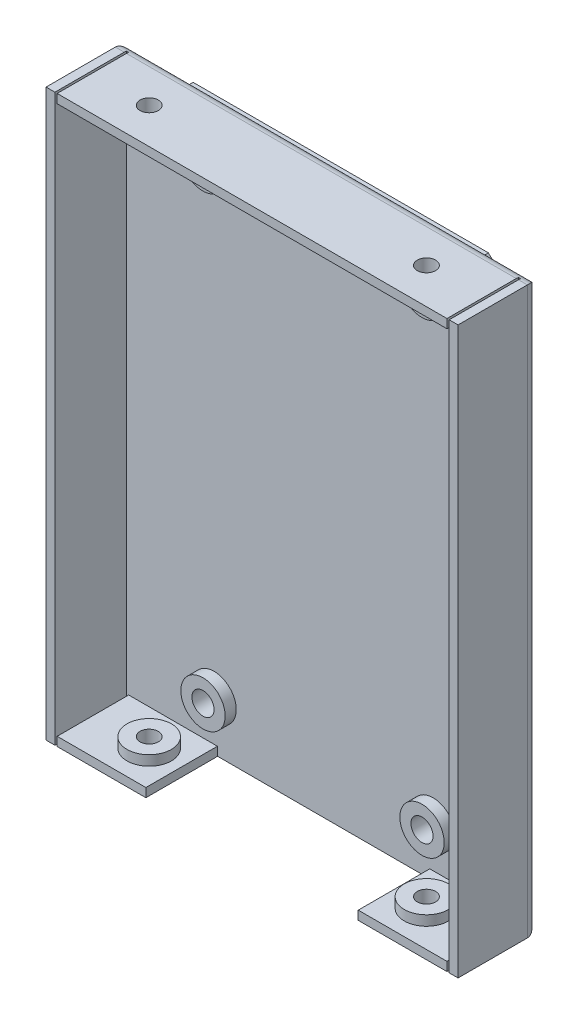
from build123d import *

# Parameters (mm, degrees)
SKETCH1_W                 = 74.3
SKETCH1_H                 = 102
BOSS_EXTRUDE1_DEPTH       = 1.6
SKETCH2_W                 = 1.6
SKETCH2_H                 = 102
SKETCH2_W_2               = 16
SKETCH2_H_2               = 1.6
SKETCH2_W_3               = 70.3
BOSS_EXTRUDE2_DEPTH       = 12.9
FILLET1_R                 = 2
SKETCH3_R                 = 4
SKETCH3_R_2               = 2
BOSS_EXTRUDE3_DEPTH       = 2
CUT_EXTRUDE1_START        = -1.6
SKETCH3_3_R               = 2
CUT_EXTRUDE1_DEPTH        = 1.6
SKETCH4_W                 = 62.25
SKETCH4_H                 = 97.2
SKETCH4_R                 = 2
SKETCH4_R_2               = 1.525
SKETCH4_W_2               = 29
SKETCH4_H_2               = 7.9
BOSS_EXTRUDE4_DEPTH       = 1.5
CHAMFER1_SIZE             = 4.5
SKETCH7_R                 = 8
SKETCH7_R_2               = 6.75
BOSS_EXTRUDE5_DEPTH       = 2.8
SKETCH9_R                 = 1.65
CUT_EXTRUDE4_DEPTH        = 126.741401296
BOSS_EXTRUDE7_START       = 1.8
SKETCH9_6_R               = 4
SKETCH9_6_R_2             = 1.65
BOSS_EXTRUDE7_DEPTH       = 1.8
MIRROR3_COPY_1_SKETCH_R   = 1.65
MIRROR3_COPY_1_DEPTH      = 126.741401296
MIRROR3_START             = 1.8
MIRROR3_COPY_2_SKETCH_R   = 4
MIRROR3_COPY_2_SKETCH_R_2 = 1.65
MIRROR3_COPY_2_DEPTH      = 1.8


with BuildPart() as part:
    # Sketch1 → Boss-Extrude1 (new body)
    with BuildSketch(Plane.XY):
        with Locations((37.15, 51)):
            Rectangle(SKETCH1_W, SKETCH1_H)
    extrude(amount=BOSS_EXTRUDE1_DEPTH)

    # Sketch2 → Boss-Extrude2 (add)
    with BuildSketch(Plane.XY.offset(1.6)):
        with Locations((0.8, 51)):
            Rectangle(SKETCH2_W, SKETCH2_H)
        with Locations((73.5, 51)):
            Rectangle(SKETCH2_W, SKETCH2_H)
        with Locations((64.3, 0.8)):
            Rectangle(SKETCH2_W_2, SKETCH2_H_2)
        with Locations((37.15, 101.2)):
            Rectangle(SKETCH2_W_3, SKETCH2_H_2)
        with Locations((10, 0.8)):
            Rectangle(SKETCH2_W_2, SKETCH2_H_2)
    extrude(amount=BOSS_EXTRUDE2_DEPTH)

    # Fillet1
    # the kernel refuses this fillet: 2 mm, written as the material it takes off along each edge
    with BuildSketch(Plane(origin=(0, 107, 0), x_dir=(1, 0, 0), z_dir=(0, -1, 0)), Plane(origin=(74.3, -5, 0), x_dir=(-1, 0, 0), z_dir=(0, 1, 0))) as fillet1_piece_1:
        with BuildLine():
            CenterArc((FILLET1_R, FILLET1_R), FILLET1_R, 180, 90)
            Line((0, FILLET1_R), (0, 0))
            Line((0, 0), (FILLET1_R, 0))
        make_face()
    extrude(amount=112, mode=Mode.SUBTRACT)
    with BuildSketch(Plane(origin=(-5, 0, 0), x_dir=(0, 0, 1), z_dir=(1, 0, 0))) as fillet1_piece_2:
        with BuildLine():
            CenterArc((FILLET1_R, -FILLET1_R), FILLET1_R, 90, 90)
            Line((0, -FILLET1_R), (0, 0))
            Line((0, 0), (FILLET1_R, 0))
        make_face()
    extrude(amount=84.3, mode=Mode.SUBTRACT)
    with BuildSketch(Plane(origin=(79.3, 102, 0), x_dir=(0, -1, 0), z_dir=(-1, 0, 0))) as fillet1_piece_3:
        with BuildLine():
            CenterArc((FILLET1_R, FILLET1_R), FILLET1_R, 180, 90)
            Line((0, FILLET1_R), (0, 0))
            Line((0, 0), (FILLET1_R, 0))
        make_face()
    extrude(amount=84.3, mode=Mode.SUBTRACT)

    # Sketch3 → Boss-Extrude3 (add)
    # profile 1 of 4: a face of its own
    with BuildSketch(Plane.XY.offset(1.6)):
        with Locations(Location((17.4, 9, 0), (0, 0, 180))):
            Circle(SKETCH3_R)
        with Locations((17.4, 9)):
            Circle(SKETCH3_R_2, mode=Mode.SUBTRACT)
    # profile 2 of 4: a face of its own
    with BuildSketch(Plane.XY.offset(1.6)):
        with Locations(Location((56.9, 9, 0), (0, 0, 180))):
            Circle(SKETCH3_R)
        with Locations(Location((56.9, 9, 0), (0, 0, 180))):
            Circle(SKETCH3_R_2, mode=Mode.SUBTRACT)
    # profile 3 of 4: a face of its own
    with BuildSketch(Plane.XY.offset(1.6)):
        with Locations(Location((56.9, 93, 0), (0, 0, 180))):
            Circle(SKETCH3_R)
        with Locations((56.9, 93)):
            Circle(SKETCH3_R_2, mode=Mode.SUBTRACT)
    # profile 4 of 4: a face of its own
    with BuildSketch(Plane.XY.offset(1.6)):
        with Locations(Location((17.4, 93, 0), (0, 0, 180))):
            Circle(SKETCH3_R)
        with Locations(Location((17.4, 93, 0), (0, 0, 180))):
            Circle(SKETCH3_R_2, mode=Mode.SUBTRACT)
    extrude(amount=BOSS_EXTRUDE3_DEPTH)

    # Sketch3<3> → Cut-Extrude1 (cut)
    with BuildSketch(Plane.XY.offset(1.6).offset(CUT_EXTRUDE1_START)):
        with Locations((17.4, 9)):
            Circle(SKETCH3_3_R)
        with Locations(Location((56.9, 9, 0), (0, 0, 180))):
            Circle(SKETCH3_3_R)
        with Locations((56.9, 93)):
            Circle(SKETCH3_3_R)
        with Locations(Location((17.4, 93, 0), (0, 0, 180))):
            Circle(SKETCH3_3_R)
    extrude(amount=CUT_EXTRUDE1_DEPTH, mode=Mode.SUBTRACT)

    # Sketch9 → Cut-Extrude4 (cut, through all)
    with BuildSketch(Plane(origin=(0, 1.6, 0), x_dir=(1, 0, 0), z_dir=(0, 1, 0))):
        with Locations(Location((12.15, -8.05, 0), (0, 0, 270))):
            Circle(SKETCH9_R)
    cut_extrude4 = extrude(amount=-CUT_EXTRUDE4_DEPTH, mode=Mode.SUBTRACT)

    # Sketch9<6> → Boss-Extrude7 (add)
    with BuildSketch(Plane(origin=(0, 1.6, 0), x_dir=(1, 0, 0), z_dir=(0, 1, 0)).offset(BOSS_EXTRUDE7_START)):
        with Locations(Location((12.15, -8.05, 0), (0, 0, 90))):
            Circle(SKETCH9_6_R)
        with Locations(Location((12.15, -8.05, 0), (0, 0, 270))):
            Circle(SKETCH9_6_R_2, mode=Mode.SUBTRACT)
    boss_extrude7 = extrude(amount=-BOSS_EXTRUDE7_DEPTH)

    # Mirror2: Cut-Extrude4, Boss-Extrude7 across plane
    add(cut_extrude4.mirror(Plane(origin=(37.15, 0, 0), x_dir=(0, 0, 1), z_dir=(1, 0, 0))), mode=Mode.SUBTRACT)
    add(boss_extrude7.mirror(Plane(origin=(37.15, 0, 0), x_dir=(0, 0, 1), z_dir=(1, 0, 0))))

    # Mirror3: Cut-Extrude4, Boss-Extrude7 across plane
    add(cut_extrude4.mirror(Plane.ZX.offset(51)), mode=Mode.SUBTRACT)
    add(boss_extrude7.mirror(Plane.ZX.offset(51)))

    # Mirror3 copy 1 sketch → Mirror3 copy 1 (cut, through all)
    with BuildSketch(Plane(origin=(74.3, 100.4, 0), x_dir=(-1, 0, 0), z_dir=(0, -1, 0))):
        with Locations(Location((12.15, -8.05, 0), (0, 0, 270))):
            Circle(MIRROR3_COPY_1_SKETCH_R)
    extrude(amount=-MIRROR3_COPY_1_DEPTH, mode=Mode.SUBTRACT)

    # Mirror3 copy 2 sketch → Mirror3 copy 2 (add)
    with BuildSketch(Plane(origin=(74.3, 100.4, 0), x_dir=(-1, 0, 0), z_dir=(0, -1, 0)).offset(MIRROR3_START)):
        with Locations(Location((12.15, -8.05, 0), (0, 0, 90))):
            Circle(MIRROR3_COPY_2_SKETCH_R)
        with Locations(Location((12.15, -8.05, 0), (0, 0, 270))):
            Circle(MIRROR3_COPY_2_SKETCH_R_2, mode=Mode.SUBTRACT)
    extrude(amount=-MIRROR3_COPY_2_DEPTH)


with BuildPart() as body_2:
    # Sketch4 → Boss-Extrude4 (new body)
    with BuildSketch(Plane(origin=(0, 0, 0), x_dir=(-1, 0, 0), z_dir=(0, 0, -1))):
        with Locations((-37.15, 51.4)):
            Rectangle(SKETCH4_W, SKETCH4_H)
        with Locations((-56.9, 93)):
            Circle(SKETCH4_R, mode=Mode.SUBTRACT)
        with Locations((-17.4, 93)):
            Circle(SKETCH4_R, mode=Mode.SUBTRACT)
        with Locations((-17.4, 9)):
            Circle(SKETCH4_R, mode=Mode.SUBTRACT)
        with Locations((-56.9, 9)):
            Circle(SKETCH4_R, mode=Mode.SUBTRACT)
        with Locations((-55.55, 64.55)):
            Circle(SKETCH4_R_2, mode=Mode.SUBTRACT)
        with Locations(Location((-18.75, 64.55, 0), (0, 0, 180))):
            Circle(SKETCH4_R_2, mode=Mode.SUBTRACT)
        with Locations((-55.55, 24.55)):
            Circle(SKETCH4_R_2, mode=Mode.SUBTRACT)
        with Locations(Location((-18.75, 24.55, 0), (0, 0, 180))):
            Circle(SKETCH4_R_2, mode=Mode.SUBTRACT)
        with Locations((-37.15, 64.55)):
            Rectangle(SKETCH4_W_2, SKETCH4_H_2, mode=Mode.SUBTRACT)
    extrude(amount=BOSS_EXTRUDE4_DEPTH)

    # Chamfer1
    chamfer1_edges = [body_2.edges().sort_by_distance(p)[0] for p in [
        (68.275, 100, -0.75),
        (6.025, 100, -0.75),
        (6.025, 2.8, -0.75),
        (68.275, 2.8, -0.75),
    ]]
    chamfer(chamfer1_edges, length=CHAMFER1_SIZE)

    # Loft1: read off the stored shape, not the designer's step
    # Loft1: loft between two sections, ruled curve by curve
    loft1_from = [
        Edge.make_bspline([(49.607117822, 33.858855013, -1.5), (27.324827848, 45.19461937, -1.5), (38.660592205, 67.476909343, -1.5), (60.942882178, 56.141144987, -1.5), (83.225172152, 44.80538063, -1.5), (71.889407795, 22.523090657, -1.5), (49.607117822, 33.858855013, -1.5)], [0, 0, 0, 0, 0.5, 0.5, 0.5, 1, 1, 1, 1], 3, [1, 0.333333333, 0.333333333, 1, 0.333333333, 0.333333333, 1]),
    ]
    loft1_to = [
        Edge.make_bspline([(54.517129402, 37.035978895, -4.1), (38.589087193, 38.551720091, -4.1), (40.104828388, 54.4797623, -4.1), (56.032870598, 52.964021105, -4.1), (71.960912807, 51.448279909, -4.1), (70.445171612, 35.5202377, -4.1), (54.517129402, 37.035978895, -4.1)], [0, 0, 0, 0, 0.5, 0.5, 0.5, 1, 1, 1, 1], 3, [1, 0.333333333, 0.333333333, 1, 0.333333333, 0.333333333, 1]),
    ]
    loft1 = Solid(Shell([*[Face.make_surface_from_curves(loft1_from[k], loft1_to[k]) for k in range(1)], Face(Wire(loft1_from)), Face(Wire(loft1_to))]))
    add(loft1)

    # Mirror1: Loft1 across plane
    add(loft1.mirror(Plane(origin=(37.15, 0, 0), x_dir=(0, 0, 1), z_dir=(1, 0, 0))))

    # Sketch7 → Boss-Extrude5 (add)
    # profile 1 of 2: a face of its own
    with BuildSketch(Plane(origin=(0, 0, -4.1), x_dir=(-1, 0, 0), z_dir=(0, 0, -1))):
        with Locations(Location((-55.275, 45, 0), (0, 0, 275.436))):
            Circle(SKETCH7_R)
        with Locations((-55.275, 45)):
            Circle(SKETCH7_R_2, mode=Mode.SUBTRACT)
    # profile 2 of 2: a face of its own
    with BuildSketch(Plane(origin=(0, 0, -4.1), x_dir=(-1, 0, 0), z_dir=(0, 0, -1))):
        with Locations((-19.025, 45)):
            Circle(SKETCH7_R)
        with Locations((-19.025, 45)):
            Circle(SKETCH7_R_2, mode=Mode.SUBTRACT)
    extrude(amount=BOSS_EXTRUDE5_DEPTH)


solid = Compound([part.part, body_2.part])
